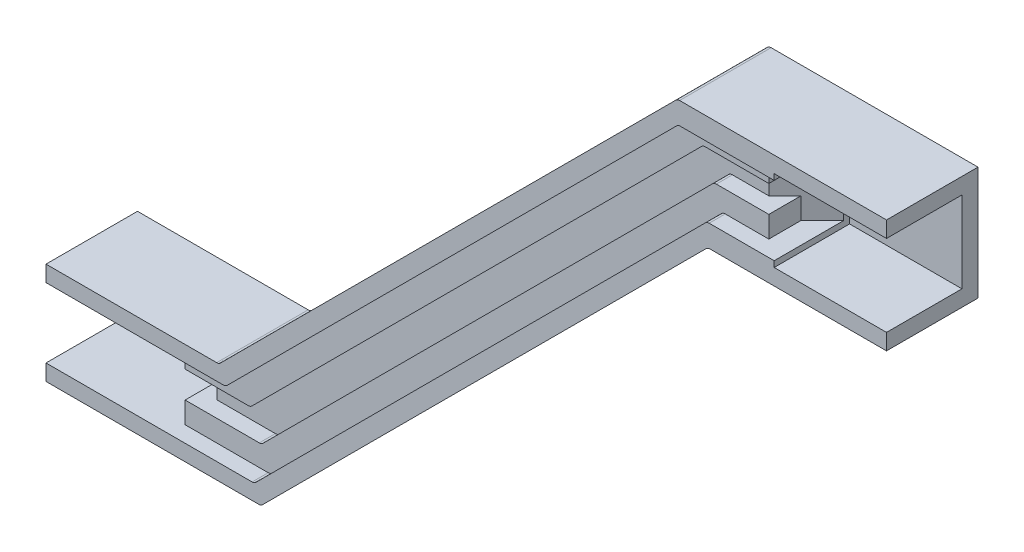
from build123d import *

# Parameters (mm, degrees)
SKETCH_10_R         = 1.65
EXTRUDE_1_DEPTH     = 3
EXTRUDE_START       = 3
EXTRUDE_2_DEPTH     = 7
EXTRUDE_3_DEPTH     = 13
CHAMFER_1_SIZE      = 7
EXTRUDE_5_DEPTH     = 10
EXTRUDE_START_2     = -1.1
SKETCH_16_R         = 1.65
EXTRUDE_6_DEPTH     = 4.1
EXTRUDE_7_DEPTH     = 16
SKETCH_18_W         = 21
SKETCH_18_H         = 15.2
CUT_EXTRUDE_1_DEPTH = 14.1
FILLET_1_R          = 1


with BuildPart() as part:
    # 草图10 → 凸台-拉伸1 (new body)
    with BuildSketch(Plane.XY):
        Polygon((-78.55, -32.8), (-46.235028843, -32.8), (38.364971157, 51.8), (78.55, 51.8), (78.55, 32.8), (46.235028843, 32.8), (-38.364971157, -51.8), (-78.55, -51.8), align=None)
        with Locations((-68.55, -42.3)):
            Circle(SKETCH_10_R, mode=Mode.SUBTRACT)
        with Locations((68.55, 42.3)):
            Circle(SKETCH_10_R, mode=Mode.SUBTRACT)
    extrude(amount=EXTRUDE_1_DEPTH)

    # 草图11 → 凸台-拉伸2 (add)
    with BuildSketch(Plane.XY.offset(EXTRUDE_START)):
        Polygon((-59.55, -32.8), (-59.55, -51.8), (-38.364971157, -51.8), (46.235028843, 32.8), (57.55, 32.8), (57.55, 51.8), (38.364971157, 51.8), (-46.235028843, -32.8), align=None)
    extrude(amount=EXTRUDE_2_DEPTH)

    # 草图12 → 凸台-拉伸3 (add)
    with BuildSketch(Plane.XY.offset(EXTRUDE_START)):
        Polygon((-78.55, -32.8), (-46.235028843, -32.8), (38.364971157, 51.8), (78.55, 51.8), (78.55, 48.8), (39.607611845, 48.8), (-44.992388155, -35.8), (-78.55, -35.8), align=None)
        Polygon((-78.55, -48.8), (-78.55, -51.8), (-38.364971157, -51.8), (46.235028843, 32.8), (78.55, 32.8), (78.55, 35.8), (44.992388155, 35.8), (-39.607611845, -48.8), align=None)
    extrude(amount=EXTRUDE_3_DEPTH)

    # 倒角1
    chamfer_1_edges = [part.edges().sort_by_distance(p)[0] for p in [
        (57.55, 42.3, 10),
        (-59.55, -42.3, 10),
    ]]
    chamfer(chamfer_1_edges, length=CHAMFER_1_SIZE - 0.0001)  # a hair under: the kernel refuses the full size

    # 草图15 → 凸台-拉伸5 (add)
    with BuildSketch(Plane.XY.offset(3)):
        Polygon((-55.55, -35.8), (-55.55, -39.8), (-43.335533906, -39.8), (41.264466094, 44.8), (53.55, 44.8), (53.55, 48.8), (39.607611845, 48.8), (-44.992388155, -35.8), align=None)
        Polygon((-55.55, -44.8), (-55.55, -48.8), (-39.607611845, -48.8), (44.992388155, 35.8), (53.55, 35.8), (53.55, 39.8), (43.335533906, 39.8), (-41.264466094, -44.8), align=None)
    extrude(amount=EXTRUDE_5_DEPTH)

    # 草图16 → 凸台-拉伸6 (add)
    with BuildSketch(Plane.XY.offset(EXTRUDE_START_2)):
        Polygon((-78.55, -32.8), (-78.55, -51.8), (-38.364971157, -51.8), (45.135028843, 31.7), (78.55, 31.7), (78.55, 52.9), (39.464971157, 52.9), (-46.235028843, -32.8), align=None)
        with Locations((-68.55, -42.3)):
            Circle(SKETCH_16_R, mode=Mode.SUBTRACT)
        with Locations((68.55, 42.3)):
            Circle(SKETCH_16_R, mode=Mode.SUBTRACT)
    extrude(amount=EXTRUDE_6_DEPTH)

    # 草图17 → 凸台-拉伸7 (add)
    with BuildSketch(Plane.XY):
        Polygon((78.55, 52.9), (78.55, 48.8), (39.607611845, 48.8), (37.486291501, 50.921320344), (39.464971157, 52.9), align=None)
        Polygon((78.55, 31.7), (45.135028843, 31.7), (43.013708499, 33.821320344), (44.992388155, 35.8), (78.55, 35.8), align=None)
    extrude(amount=EXTRUDE_7_DEPTH)

    # 草图18 → 切除-拉伸1 (cut)
    with BuildSketch(Plane.XY.offset(16)):
        with Locations((68.05, 42.3)):
            Rectangle(SKETCH_18_W, SKETCH_18_H)
    extrude(amount=-CUT_EXTRUDE_1_DEPTH, mode=Mode.SUBTRACT)


with BuildPart() as cut_extrude_1_kept_piece:
    # of the separate pieces the step leaves, the one the design keeps (cut_extrude_1_pieces_kept)
    add(part.part.solids().sort_by_distance((-59.55, -48.8, 3.0001))[0])

    # 圆角1
    fillet_1_edges = [cut_extrude_1_kept_piece.edges().sort_by_distance(p)[0] for p in [
        (-46.235028843, -32.8, 7.45),
        (-38.364971157, -51.8, 7.45),
        (-43.335533906, -39.8, 11.5),
        (41.264466094, 44.8, 11.5),
        (-41.264466094, -44.8, 11.5),
        (43.335533906, 39.8, 11.5),
        (45.135028843, 31.7, 7.45),
        (39.464971157, 52.9, 7.45),
        (39.607611845, 48.8, 14.5),
        (-44.992388155, -35.8, 14.5),
        (-39.607611845, -48.8, 14.5),
        (44.992388155, 35.8, 14.5),
    ]]
    fillet(fillet_1_edges, radius=FILLET_1_R)


solid = cut_extrude_1_kept_piece.part
